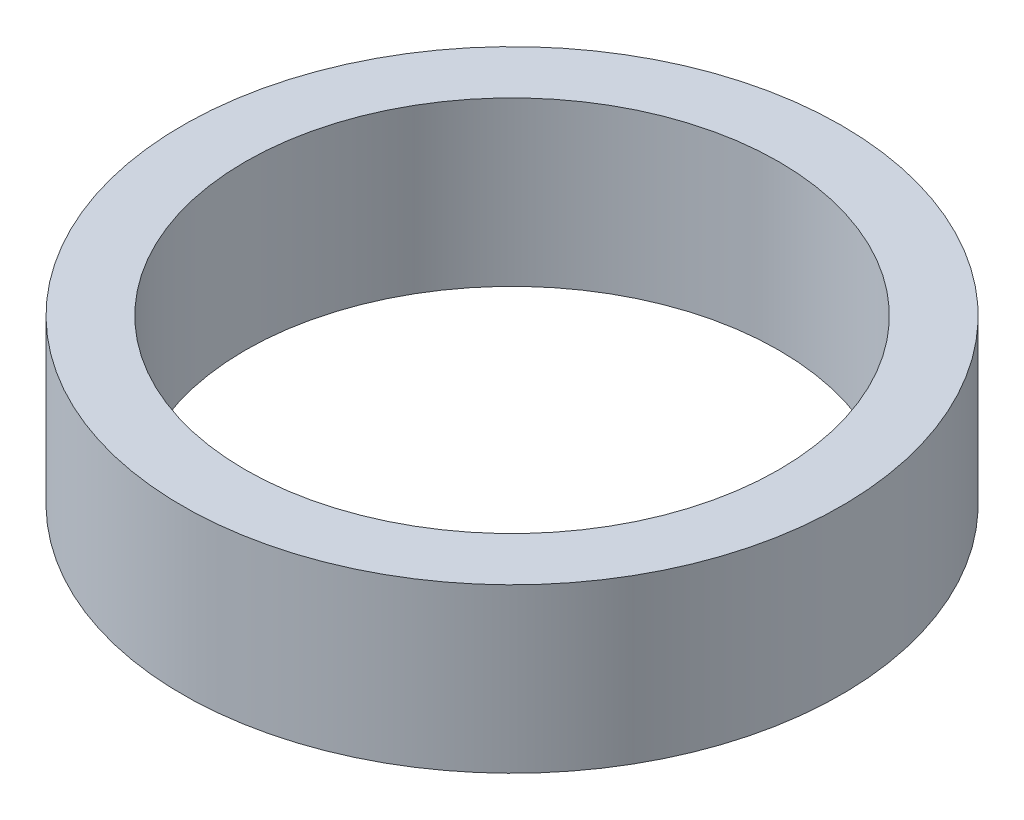
from build123d import *

# Parameters (mm, degrees)
SKETCH1_R           = 52.5
BOSS_EXTRUDE1_DEPTH = 26
SKETCH2_R           = 42.5
CUT_EXTRUDE1_DEPTH  = 79.667019773


with BuildPart() as part:
    # Sketch1 → Boss-Extrude1 (new body)
    with BuildSketch(Plane(origin=(0, 0, 0), x_dir=(1, 0, 0), z_dir=(0, 1, 0))):
        Circle(SKETCH1_R)
    extrude(amount=BOSS_EXTRUDE1_DEPTH)

    # Sketch2 → Cut-Extrude1 (cut, through all)
    with BuildSketch(Plane(origin=(0, 0, 0), x_dir=(1, 0, 0), z_dir=(0, 1, 0))):
        Circle(SKETCH2_R)
    extrude(amount=CUT_EXTRUDE1_DEPTH, mode=Mode.SUBTRACT)


solid = part.part
